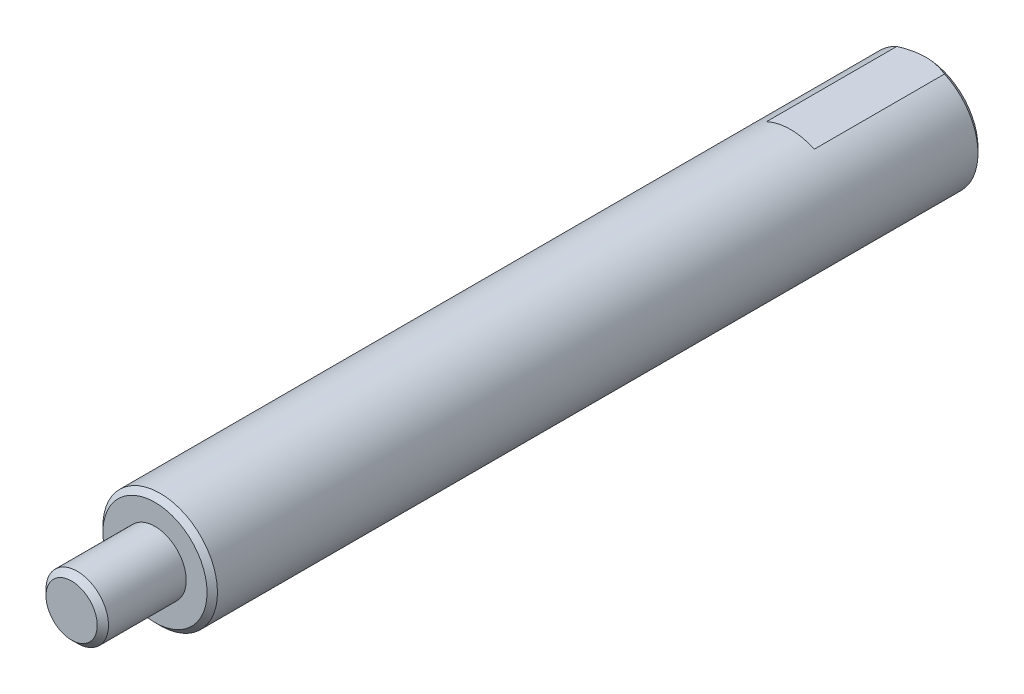
from build123d import *

# Parameters (mm, degrees)
SKETCH_1_R             = 5.5
EXTRUDE_1_DEPTH        = 74
CHAMFER_1_SIZE         = 0.5
SKETCH_2_R             = 3.3
EXTRUDE_2_DEPTH        = 8
HOLE_WIZARD_M5_1_D     = 4.2
HOLE_WIZARD_M5_1_DEPTH = 12.4
HOLE_WIZARD_M5_1_TIP   = 1.2618073
CHAMFER_3_SIZE         = 0.5
SKETCH_6_W             = 10
SKETCH_6_H             = 3
CUT_EXTRUDE_1_DEPTH    = 13


# Read off the part's stored shape, not the designer's step: M6 机械螺纹 螺柱1
with BuildPart() as part:
    # 草图1 → 拉伸1 (new body)
    with BuildSketch(Plane.XY):
        Circle(SKETCH_1_R)
    extrude(amount=EXTRUDE_1_DEPTH)

    # 倒角1
    chamfer_1_edges = [part.edges().sort_by_distance(p)[0] for p in [
        (-5.5, 0, 0),
        (-5.5, 0, 74),
    ]]
    chamfer(chamfer_1_edges, length=CHAMFER_1_SIZE)

    # 草图2 → 拉伸2 (add)
    with BuildSketch(Plane.XY.offset(74)):
        Circle(SKETCH_2_R)
    extrude(amount=EXTRUDE_2_DEPTH)

    # M5 螺纹孔1
    with Locations(Plane(origin=(0, 0, 0), x_dir=(-1, 0, 0), z_dir=(0, 0, -1))):
        with Locations((0, 0)):
            Hole(HOLE_WIZARD_M5_1_D / 2, depth=HOLE_WIZARD_M5_1_DEPTH)
            with Locations((0, 0, -(HOLE_WIZARD_M5_1_DEPTH + HOLE_WIZARD_M5_1_TIP / 2))):  # 118° drill point
                Cone(0, HOLE_WIZARD_M5_1_D / 2, HOLE_WIZARD_M5_1_TIP, mode=Mode.SUBTRACT)

    # 倒角3
    chamfer_3_edges = [part.edges().sort_by_distance(p)[0] for p in [
        (-2.1, 0, 0),
    ]]
    chamfer(chamfer_3_edges, length=CHAMFER_3_SIZE)

    # 草图6 → 切除-拉伸1 (cut)
    with BuildSketch(Plane(origin=(0, 0, 0), x_dir=(-1, 0, 0), z_dir=(0, 0, -1))):
        with Locations((0, 6.5)):
            Rectangle(SKETCH_6_W, SKETCH_6_H)
        with Locations((0, -6.5)):
            Rectangle(SKETCH_6_W, SKETCH_6_H)
    extrude(amount=-CUT_EXTRUDE_1_DEPTH, mode=Mode.SUBTRACT)

    # M6 机械螺纹 螺柱1 outline → M6 机械螺纹 螺柱1 (revolve, cut)
    with BuildSketch(Plane.XZ):
        Polygon((3.3, 82), (2.4585, 82), (3, 81.4585), (3, 74), (3.3, 74), align=None)
    revolve(axis=Axis((0, 0, 0), (0, 0, 1)), mode=Mode.SUBTRACT)


solid = part.part
